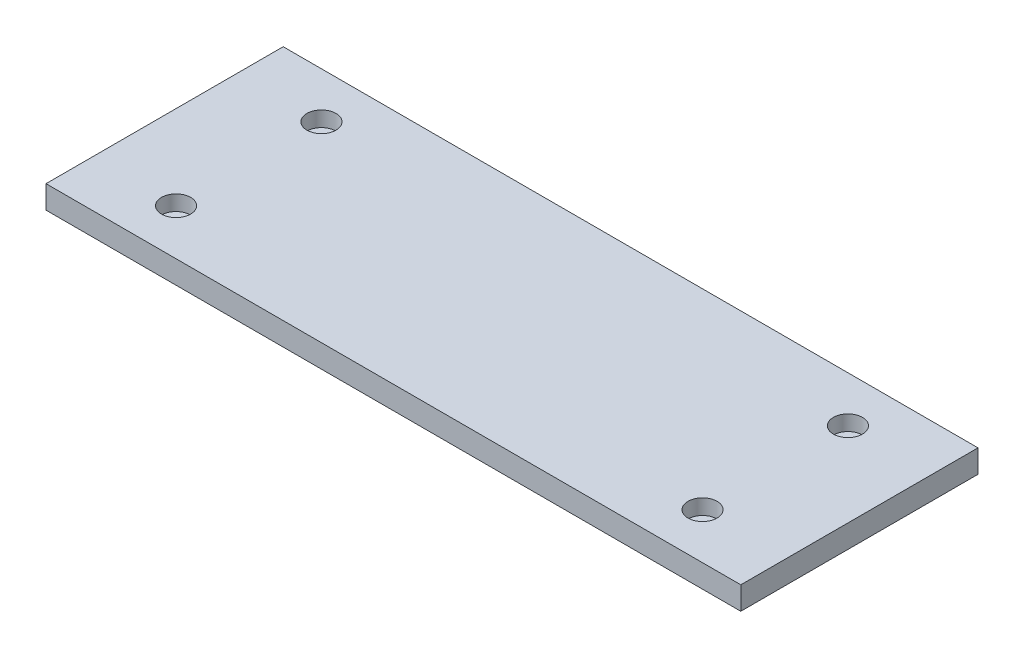
from build123d import *

# Parameters (mm, degrees)
SKETCH1_W           = 90.8
SKETCH1_H           = 31
BOSS_EXTRUDE1_DEPTH = 3
SKETCH2_R           = 0.95
CUT_EXTRUDE1_DEPTH  = 3
SKETCH3_R           = 1.9
CUT_EXTRUDE2_DEPTH  = 2
SKETCH4_W           = 54
SKETCH4_H           = 7
BOSS_EXTRUDE2_DEPTH = 3
SKETCH5_R           = 3.9
CUT_EXTRUDE3_DEPTH  = 54


with BuildPart() as part:
    # Sketch1 → Boss-Extrude1 (new body)
    with BuildSketch(Plane(origin=(0, 0, 0), x_dir=(1, 0, 0), z_dir=(0, 1, 0))):
        Rectangle(SKETCH1_W, SKETCH1_H)
    extrude(amount=BOSS_EXTRUDE1_DEPTH)

    # Sketch2 → Cut-Extrude1 (cut)
    with BuildSketch(Plane(origin=(0, 3, 0), x_dir=(1, 0, 0), z_dir=(0, 1, 0))):
        with Locations((-34.4, 9.5)):
            Circle(SKETCH2_R)
        with Locations((34.4, 9.5)):
            Circle(SKETCH2_R)
        with Locations((-34.4, -9.5)):
            Circle(SKETCH2_R)
        with Locations((34.4, -9.5)):
            Circle(SKETCH2_R)
    extrude(amount=-CUT_EXTRUDE1_DEPTH, mode=Mode.SUBTRACT)

    # Sketch3 → Cut-Extrude2 (cut)
    with BuildSketch(Plane(origin=(0, 3, 0), x_dir=(1, 0, 0), z_dir=(0, 1, 0))):
        with Locations((-34.4, 9.5)):
            Circle(SKETCH3_R)
        with Locations((-34.4, -9.5)):
            Circle(SKETCH3_R)
        with Locations((34.4, 9.5)):
            Circle(SKETCH3_R)
        with Locations((34.4, -9.5)):
            Circle(SKETCH3_R)
    extrude(amount=-CUT_EXTRUDE2_DEPTH, mode=Mode.SUBTRACT)

    # Sketch4 → Boss-Extrude2 (add)
    with BuildSketch(Plane.XZ):
        Rectangle(SKETCH4_W, SKETCH4_H)
    extrude(amount=BOSS_EXTRUDE2_DEPTH)

    # Sketch5 → Cut-Extrude3 (cut)
    with BuildSketch(Plane(origin=(27, 0, 0), x_dir=(0, 0, -1), z_dir=(1, 0, 0))):
        with Locations((0, -4.130658567)):
            Circle(SKETCH5_R)
    extrude(amount=-CUT_EXTRUDE3_DEPTH, mode=Mode.SUBTRACT)


solid = part.part
